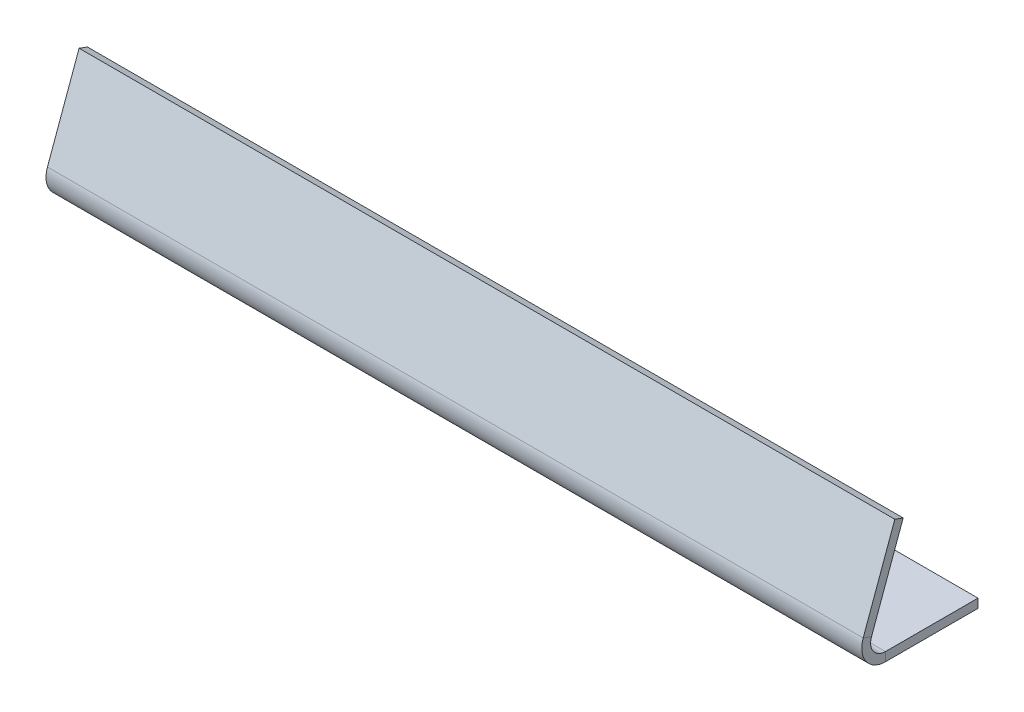
from build123d import *

# Parameters (mm, degrees)
SKETCH5_W              = 55.1
SKETCH5_H              = 15
BASE_FLANGE1_DEPTH     = 0.6
SKETCHED_START         = -27.55
SKETCHED_BEND2_DEPTH   = 55.1
SKETCHED_BEND2_2_DEPTH = 55.1


# Read off the part's stored shape, not the designer's step: Sketched Bend2
# Sheet-metal steps are written as plain solids
with BuildPart() as part:
    # Sketch5 → Base-Flange1 (new body)
    with BuildSketch(Plane(origin=(0, 0, 0), x_dir=(1, 0, 0), z_dir=(0, 1, 0))):
        Rectangle(SKETCH5_W, SKETCH5_H)
    extrude(amount=-BASE_FLANGE1_DEPTH)

    # Sketched Bend2 outline → Sketched Bend2 (cut)
    with BuildSketch(Plane.YZ.offset(SKETCHED_START)):
        with BuildLine():
            ThreePointArc((-0.6, -1.247910415), (-0.44222051, -0.555090092), (0, 0.001089185))
            Line((0, 0.001089185), (0, 7.5))
            Line((0, 7.5), (-0.6, 7.5))
            Line((-0.6, 7.5), (-0.6, -1.247910415))
        make_face()
    extrude(amount=SKETCHED_BEND2_DEPTH, mode=Mode.SUBTRACT)

    # Sketched Bend2 2 outline → Sketched Bend2 2 (add)
    with BuildSketch(Plane.YZ.offset(SKETCHED_START)):
        with BuildLine():
            Line((7.217062591, -2.44655837), (7.422274677, -1.882742798))
            Line((7.422274677, -1.882742798), (1.547232229, 0.255597778))
            ThreePointArc((1.547232229, 0.255597778), (0.740301483, 0.330872876), (0, 0.001089185))
            Line((0, 0.001089185), (0, -1.247910415))
            ThreePointArc((0, -1.247910415), (0.426423564, -0.428758371), (1.342020143, -0.308217794))
            Line((1.342020143, -0.308217794), (7.217062591, -2.44655837))
        make_face()
    extrude(amount=SKETCHED_BEND2_2_DEPTH)


solid = part.part
